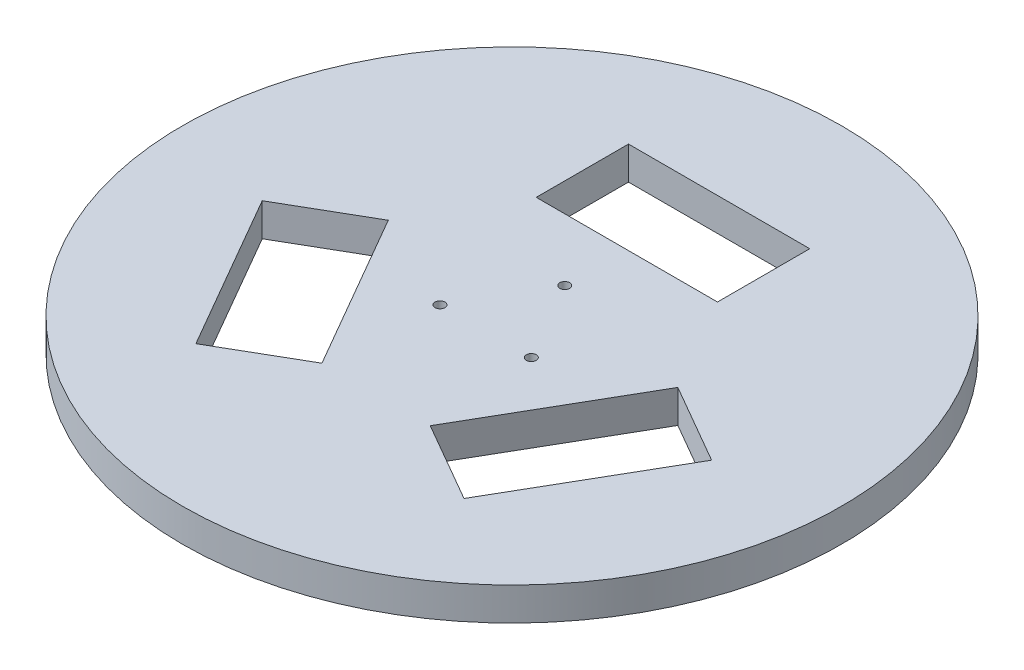
from build123d import *

# Parameters (mm, degrees)
SKETCH2_R           = 100
SKETCH2_R_2         = 1.5
SKETCH2_W           = 55
SKETCH2_H           = 28
BOSS_EXTRUDE1_DEPTH = 10


with BuildPart() as part:
    # Sketch2 → Boss-Extrude1 (new body)
    with BuildSketch(Plane(origin=(0, 0, 0), x_dir=(1, 0, 0), z_dir=(0, 1, 0))):
        Circle(SKETCH2_R)
        with Locations((0, 16)):
            Circle(SKETCH2_R_2, mode=Mode.SUBTRACT)
        with Locations((13.856406461, -8)):
            Circle(SKETCH2_R_2, mode=Mode.SUBTRACT)
        with Locations((-13.856406461, -8)):
            Circle(SKETCH2_R_2, mode=Mode.SUBTRACT)
        with Locations((0, 48.851669886)):
            Rectangle(SKETCH2_W, SKETCH2_H, mode=Mode.SUBTRACT)
        Polygon((68.181142791, -7.610136339), (40.681142791, -55.241533547), (16.432431485, -41.241533547), (43.932431485, 6.389863661), align=None, mode=Mode.SUBTRACT)
        Polygon((-40.681142791, -55.241533547), (-68.181142791, -7.610136339), (-43.932431485, 6.389863661), (-16.432431485, -41.241533547), align=None, mode=Mode.SUBTRACT)
    extrude(amount=BOSS_EXTRUDE1_DEPTH)


solid = part.part
